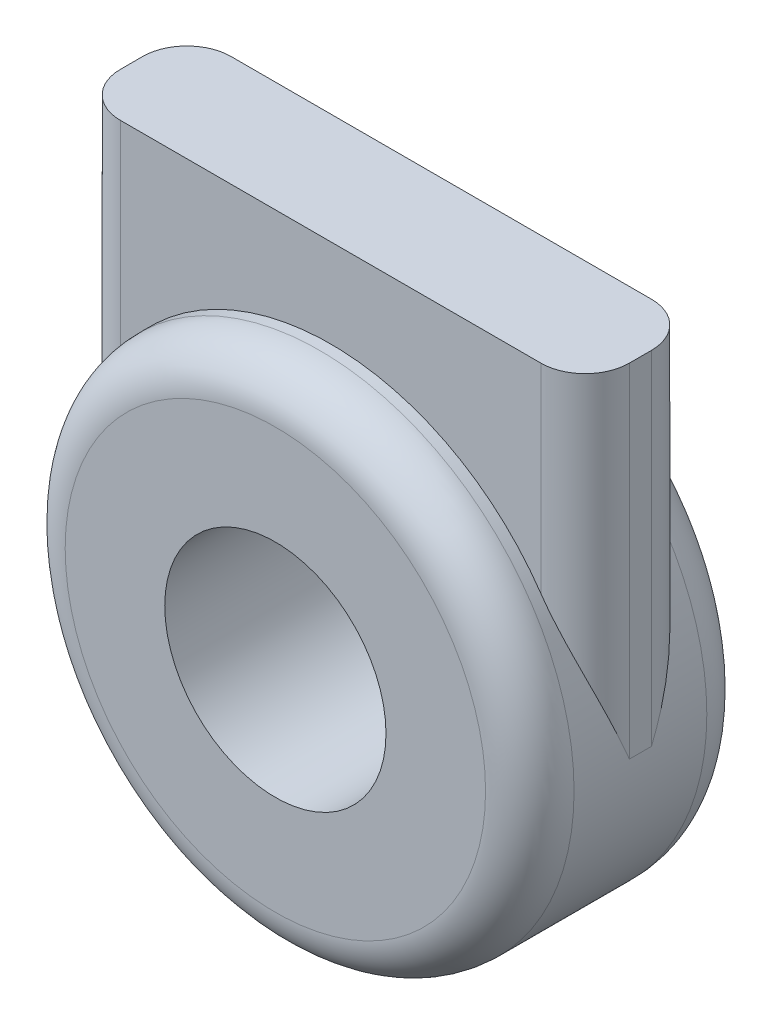
from build123d import *

# Parameters (mm, degrees)
SKETCH1_R           = 11.5
SKETCH1_R_2         = 5
SKETCH1_W           = 23
SKETCH1_H           = 4
BOSS_EXTRUDE2_DEPTH = 5
SKETCH3_R           = 11.5
BOSS_EXTRUDE3_DEPTH = 2.5
BOSS_EXTRUDE4_START = 2.5
SKETCH4_R           = 11.5
BOSS_EXTRUDE4_DEPTH = 2.5
CUT_EXTRUDE2_START  = -17.5
SKETCH5_R           = 5
CUT_EXTRUDE2_DEPTH  = 17.5
FILLET1_R           = 2


with BuildPart() as part:
    # Sketch1 → Boss-Extrude2 (new body)
    # profile 1 of 4: a face of its own
    with BuildSketch(Plane.XY):
        Circle(SKETCH1_R)
        Circle(SKETCH1_R_2, mode=Mode.SUBTRACT)
    # profile 2 of 4: a face of its own
    with BuildSketch(Plane.XY):
        with BuildLine():
            ThreePointArc((1.6e-08, 11.5), (8.131727989, 8.131727978), (11.5, 0))
            Line((11.5, 0), (11.5, 11.5))
            Line((11.5, 11.5), (1.6e-08, 11.5))
        make_face()
    # profile 3 of 4: a face of its own
    with BuildSketch(Plane.XY):
        with Locations((0, 13.5)):
            Rectangle(SKETCH1_W, SKETCH1_H)
    # profile 4 of 4: a face of its own
    with BuildSketch(Plane.XY):
        with BuildLine():
            Line((-11.5, 11.5), (-11.5, 0))
            ThreePointArc((-11.5, 0), (-8.131727978, 8.131727989), (1.6e-08, 11.5))
            Line((1.6e-08, 11.5), (-11.5, 11.5))
        make_face()
    extrude(amount=BOSS_EXTRUDE2_DEPTH)

    # Sketch3 → Boss-Extrude3 (add)
    with BuildSketch(Plane.XY.offset(5)):
        Circle(SKETCH3_R)
    extrude(amount=BOSS_EXTRUDE3_DEPTH)

    # Sketch4 → Boss-Extrude4 (add)
    with BuildSketch(Plane(origin=(0, 0, 0), x_dir=(-1, 0, 0), z_dir=(0, 0, -1)).offset(BOSS_EXTRUDE4_START)):
        Circle(SKETCH4_R)
    extrude(amount=-BOSS_EXTRUDE4_DEPTH)

    # Sketch5 → Cut-Extrude2 (cut)
    with BuildSketch(Plane.XY.offset(7.5).offset(CUT_EXTRUDE2_START)):
        with Locations(Location((0, 0, 0), (0, 0, 180))):
            Circle(SKETCH5_R)
    extrude(amount=CUT_EXTRUDE2_DEPTH, mode=Mode.SUBTRACT)

    # Fillet1
    # the kernel refuses this fillet: 2 mm, written as the material it takes off along each edge
    with BuildSketch(Plane(origin=(-11.5, 20.5, 0), x_dir=(0, 0, 1), z_dir=(0, -1, 0))) as fillet1_piece_1_section:
        with BuildLine():
            CenterArc((FILLET1_R, -FILLET1_R), FILLET1_R, 90, 90)
            Line((0, -FILLET1_R), (0, 0))
            Line((0, 0), (FILLET1_R, 0))
        make_face()
    fillet1_piece_1 = extrude(amount=25.5, mode=Mode.PRIVATE)
    fillet1_piece_1 = fillet1_piece_1 - Plane(origin=(0, 0, 0.471607453), x_dir=(1, 0, 0), z_dir=(0, 0, -1)) * Cylinder(11.5, 59, mode=Mode.PRIVATE)
    add(fillet1_piece_1, mode=Mode.SUBTRACT)
    with BuildSketch(Plane(origin=(-11.5, 20.5, 5), x_dir=(1, 0, 0), z_dir=(0, -1, 0))) as fillet1_piece_2_section:
        with BuildLine():
            CenterArc((FILLET1_R, -FILLET1_R), FILLET1_R, 90, 90)
            Line((0, -FILLET1_R), (0, 0))
            Line((0, 0), (FILLET1_R, 0))
        make_face()
    fillet1_piece_2 = extrude(amount=25.5, mode=Mode.PRIVATE)
    fillet1_piece_2 = fillet1_piece_2 - Plane(origin=(0, 0, 4.528392342), x_dir=(1, 0, 0), z_dir=(0, 0, -1)) * Cylinder(11.5, 59, mode=Mode.PRIVATE)
    add(fillet1_piece_2, mode=Mode.SUBTRACT)
    with BuildSketch(Plane(origin=(11.5, -5, 0), x_dir=(0, 0, 1), z_dir=(0, 1, 0))) as fillet1_piece_3_section:
        with BuildLine():
            CenterArc((FILLET1_R, -FILLET1_R), FILLET1_R, 90, 90)
            Line((0, -FILLET1_R), (0, 0))
            Line((0, 0), (FILLET1_R, 0))
        make_face()
    fillet1_piece_3 = extrude(amount=25.5, mode=Mode.PRIVATE)
    fillet1_piece_3 = fillet1_piece_3 - Plane(origin=(0, 0, 0.471608914), x_dir=(1, 0, 0), z_dir=(0, 0, -1)) * Cylinder(11.5, 59, mode=Mode.PRIVATE)
    add(fillet1_piece_3, mode=Mode.SUBTRACT)
    with BuildSketch(Plane(origin=(11.5, 20.5, 5), x_dir=(0, 0, -1), z_dir=(0, -1, 0))) as fillet1_piece_4_section:
        with BuildLine():
            CenterArc((FILLET1_R, -FILLET1_R), FILLET1_R, 90, 90)
            Line((0, -FILLET1_R), (0, 0))
            Line((0, 0), (FILLET1_R, 0))
        make_face()
    fillet1_piece_4 = extrude(amount=25.5, mode=Mode.PRIVATE)
    fillet1_piece_4 = fillet1_piece_4 - Plane(origin=(0, 0, 4.528391109), x_dir=(1, 0, 0), z_dir=(0, 0, -1)) * Cylinder(11.5, 59, mode=Mode.PRIVATE)
    add(fillet1_piece_4, mode=Mode.SUBTRACT)
    with BuildSketch(Plane(origin=(0, 0, 7.5), x_dir=(1, 0, 0), z_dir=(0, -1, 0))) as fillet1_piece_5:
        with BuildLine():
            CenterArc((11.5 - FILLET1_R, -FILLET1_R), FILLET1_R, 0, 90)
            Line((11.5 - FILLET1_R, 0), (11.5, 0))
            Line((11.5, 0), (11.5, -FILLET1_R))
        make_face()
    revolve(axis=Axis((0, 0, 7.5), (0, 0, 1)), mode=Mode.SUBTRACT)
    with BuildSketch(Plane(origin=(0, 0, -2.5), x_dir=(-1, 0, 0), z_dir=(0, -1, 0))) as fillet1_piece_6:
        with BuildLine():
            CenterArc((11.5 - FILLET1_R, -FILLET1_R), FILLET1_R, 0, 90)
            Line((11.5 - FILLET1_R, 0), (11.5, 0))
            Line((11.5, 0), (11.5, -FILLET1_R))
        make_face()
    revolve(axis=Axis((0, 0, -2.5), (0, 0, -1)), mode=Mode.SUBTRACT)


solid = part.part
